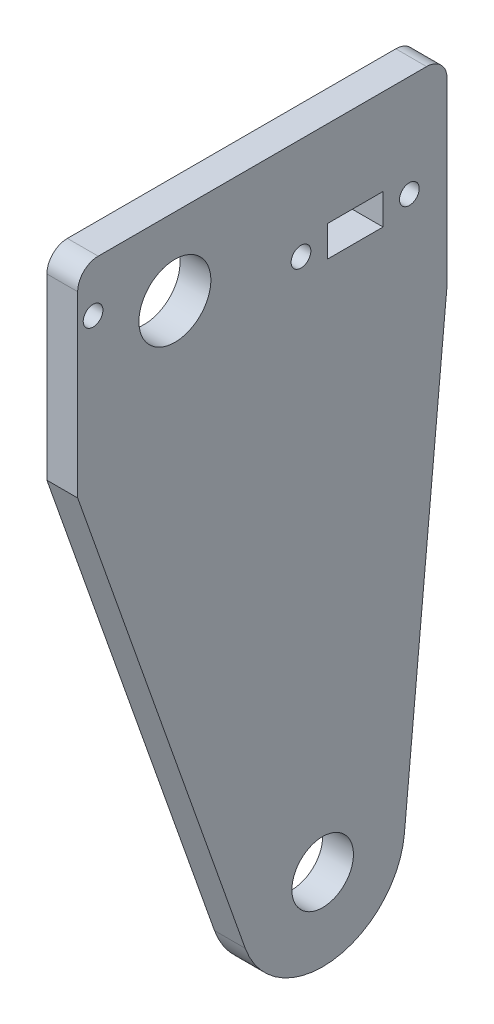
from build123d import *

# Parameters (mm, degrees)
SKETCH1_R           = 4.7625
SKETCH1_R_2         = 5.5626
SKETCH1_R_3         = 1.524
SKETCH1_W           = 8.636
SKETCH1_H           = 4.7625
BOSS_EXTRUDE1_DEPTH = 4.7625


with BuildPart() as part:
    # Sketch1 → Boss-Extrude1 (new body)
    with BuildSketch(Plane(origin=(0, 0, 0), x_dir=(0, 0, -1), z_dir=(1, 0, 0))):
        with BuildLine():
            Line((42.1132, 8.7376), (42.1132, -18.894289209))
            Line((42.1132, -18.894289209), (35.505898787, -89.148965396))
            ThreePointArc((35.505898787, -89.148965396), (24.421013785, -100.56371426), (10.888521103, -92.194556062))
            Line((10.888521103, -92.194556062), (-15.0368, -18.894289209))
            Line((-15.0368, -18.894289209), (-15.0368, 8.7376))
            ThreePointArc((-15.0368, 8.7376), (-14.10686403, 10.98266403), (-11.8618, 11.9126))
            Line((-11.8618, 11.9126), (38.9382, 11.9126))
            ThreePointArc((38.9382, 11.9126), (41.18326403, 10.98266403), (42.1132, 8.7376))
        make_face()
        with Locations((22.86169466, -87.959805189)):
            Circle(SKETCH1_R, mode=Mode.SUBTRACT)
        Circle(SKETCH1_R_2, mode=Mode.SUBTRACT)
        with Locations((-12.65555, 4.3307)):
            Circle(SKETCH1_R_3, mode=Mode.SUBTRACT)
        with Locations((36.2712, -3.8354)):
            Circle(SKETCH1_R_3, mode=Mode.SUBTRACT)
        with Locations((19.5072, -3.8354)):
            Circle(SKETCH1_R_3, mode=Mode.SUBTRACT)
        with Locations((27.8892, -3.8354)):
            Rectangle(SKETCH1_W, SKETCH1_H, mode=Mode.SUBTRACT)
    extrude(amount=BOSS_EXTRUDE1_DEPTH)


solid = part.part
